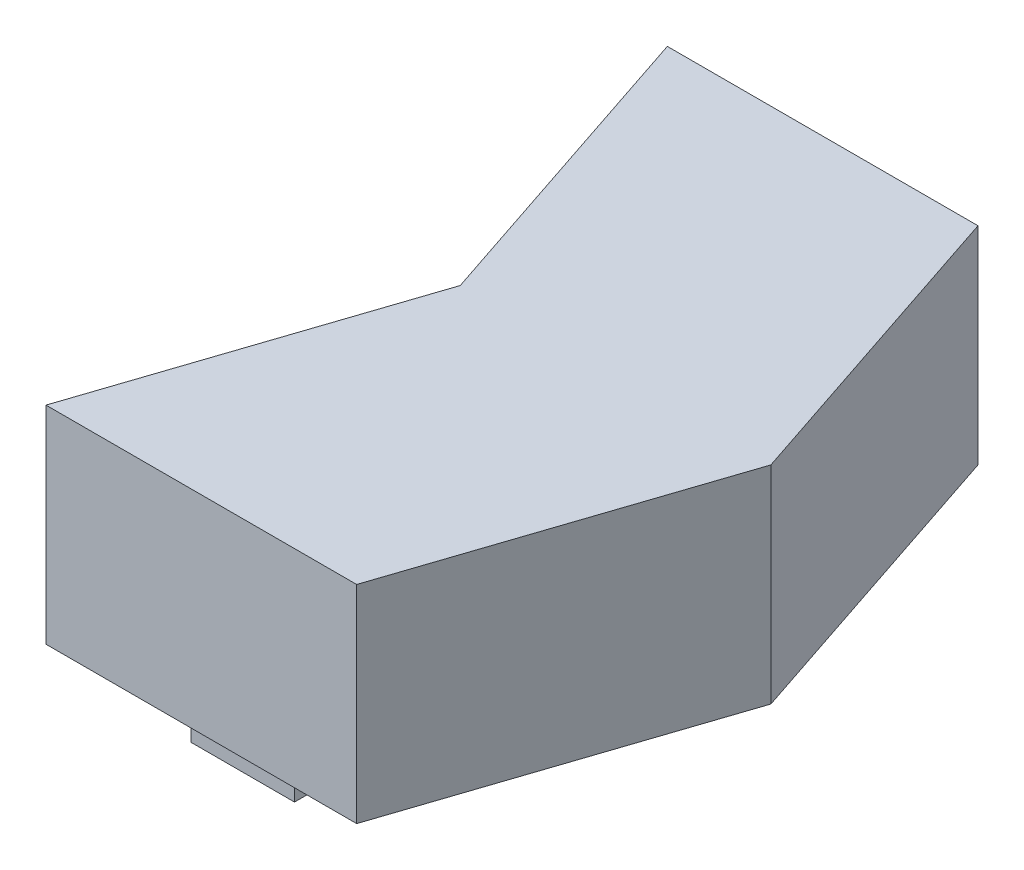
from build123d import *

# Parameters (mm, degrees)
BOSS_EXTRUDE1_DEPTH       = 12.7
SKETCH2_R                 = 5.635000033
HAPTIC_MOTOR_CUTOUT_DEPTH = 9.557999934
SKETCH3_W                 = 2.54
SKETCH3_H                 = 3.81
HAPTIC_WIRE_CUTOUT_DEPTH  = 9.557999934
SKETCH4_W                 = 6.35
SKETCH4_H                 = 2.54
PINS_DEPTH                = 2.032


with BuildPart() as part:
    # Sketch1 → Boss-Extrude1 (new body)
    with BuildSketch(Plane(origin=(0, 0, 0), x_dir=(1, 0, 0), z_dir=(0, 1, 0))):
        Polygon((0, 0), (19.05, 0), (25.4, 19.05), (19.05, 38.1), (0, 38.1), (6.35, 19.05), align=None)
    extrude(amount=BOSS_EXTRUDE1_DEPTH)

    # Sketch2 → Haptic Motor Cutout (cut)
    with BuildSketch(Plane.XZ):
        with Locations((15.24, -19.05)):
            Circle(SKETCH2_R)
    extrude(amount=-HAPTIC_MOTOR_CUTOUT_DEPTH, mode=Mode.SUBTRACT)

    # Sketch3 → Haptic Wire Cutout (cut)
    with BuildSketch(Plane.XZ):
        with Locations((15.24, -26.445020526)):
            Rectangle(SKETCH3_W, SKETCH3_H)
    extrude(amount=-HAPTIC_WIRE_CUTOUT_DEPTH, mode=Mode.SUBTRACT)

    # Sketch4 → Pins (add)
    with BuildSketch(Plane.XZ):
        with Locations((10.795, -35.56)):
            Rectangle(SKETCH4_W, SKETCH4_H)
    pins = extrude(amount=PINS_DEPTH)

    # Mirror1: Pins across plane
    add(pins.mirror(Plane(origin=(0, 0, -19.05), x_dir=(1, 0, 0), z_dir=(0, 0, -1))))


solid = part.part
